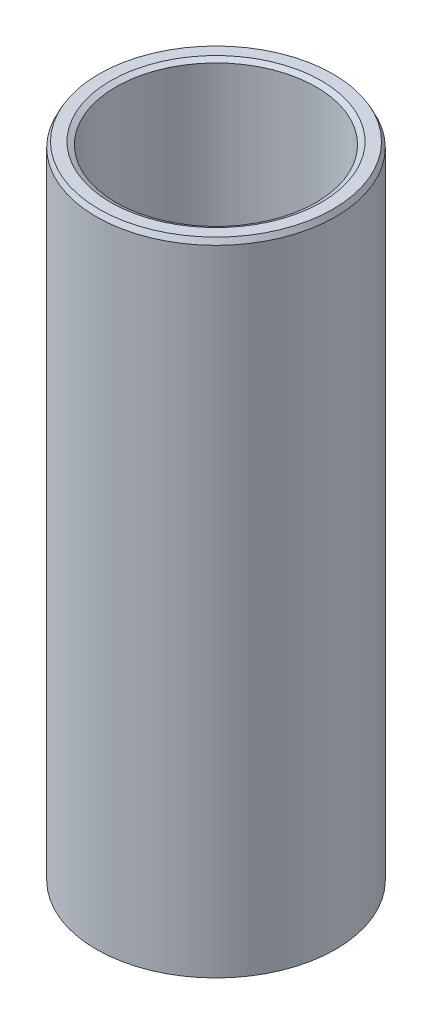
from build123d import *
from OCP.BRepFilletAPI import BRepFilletAPI_MakeChamfer

# Parameters (mm, degrees)
SKETCH1_R           = 55
BOSS_EXTRUDE1_DEPTH = 295.097850445
SKETCH2_R           = 46.004145369
CUT_EXTRUDE1_DEPTH  = 306.176574031
CHAMFER1_SIZE       = 2.407491282
CHAMFER1_SIZE2      = 1.231755155


with BuildPart() as part:
    # Sketch1 → Boss-Extrude1 (new body)
    with BuildSketch(Plane(origin=(0, 0, 0), x_dir=(1, 0, 0), z_dir=(0, 1, 0))):
        Circle(SKETCH1_R)
    extrude(amount=BOSS_EXTRUDE1_DEPTH)

    # Sketch2 → Cut-Extrude1 (cut, through all)
    with BuildSketch(Plane(origin=(0, 0, 0), x_dir=(1, 0, 0), z_dir=(0, 1, 0))):
        Circle(SKETCH2_R)
    extrude(amount=CUT_EXTRUDE1_DEPTH, mode=Mode.SUBTRACT)

    # Chamfer1: one chamfer whose edges measure the first distance from different faces: ONE call of the kernel's chamfer builder (chamfer() names one face for all edges)
    chamfer1_edges_1 = [part.edges().sort_by_distance(p)[0] for p in [
        (-46.004145369, 295.097850445, 0),
    ]]
    chamfer1_side_1 = [part.faces().sort_by_distance(p)[0] for p in [
        (-53.444365081, 295.097850445, 0),
    ]]
    chamfer1_edges_2 = [part.edges().sort_by_distance(p)[0] for p in [
        (-46.004145369, 0, 0),
    ]]
    chamfer1_side_2 = [part.faces().sort_by_distance(p)[0] for p in [
        (-46.004145369, 147.548925222, 0),
    ]]
    chamfer1_edges_3 = [part.edges().sort_by_distance(p)[0] for p in [
        (-55, 0, 0),
    ]]
    chamfer1_side_3 = [part.faces().sort_by_distance(p)[0] for p in [
        (-53.444365081, 0, 0),
    ]]
    chamfer1_edges_4 = [part.edges().sort_by_distance(p)[0] for p in [
        (-55, 295.097850445, 0),
    ]]
    chamfer1_side_4 = [part.faces().sort_by_distance(p)[0] for p in [
        (-55, 147.548925222, 0),
    ]]
    chamfer1 = BRepFilletAPI_MakeChamfer(part.part.solid().wrapped)
    for e in chamfer1_edges_1:
        chamfer1.Add(CHAMFER1_SIZE, CHAMFER1_SIZE2, e.wrapped, chamfer1_side_1[0].wrapped)  # the first distance lies on this face
    for e in chamfer1_edges_2:
        chamfer1.Add(CHAMFER1_SIZE, CHAMFER1_SIZE2, e.wrapped, chamfer1_side_2[0].wrapped)  # the first distance lies on this face
    for e in chamfer1_edges_3:
        chamfer1.Add(CHAMFER1_SIZE, CHAMFER1_SIZE2, e.wrapped, chamfer1_side_3[0].wrapped)  # the first distance lies on this face
    for e in chamfer1_edges_4:
        chamfer1.Add(CHAMFER1_SIZE, CHAMFER1_SIZE2, e.wrapped, chamfer1_side_4[0].wrapped)  # the first distance lies on this face
    add(Compound.cast(chamfer1.Shape()), mode=Mode.REPLACE)


solid = part.part
